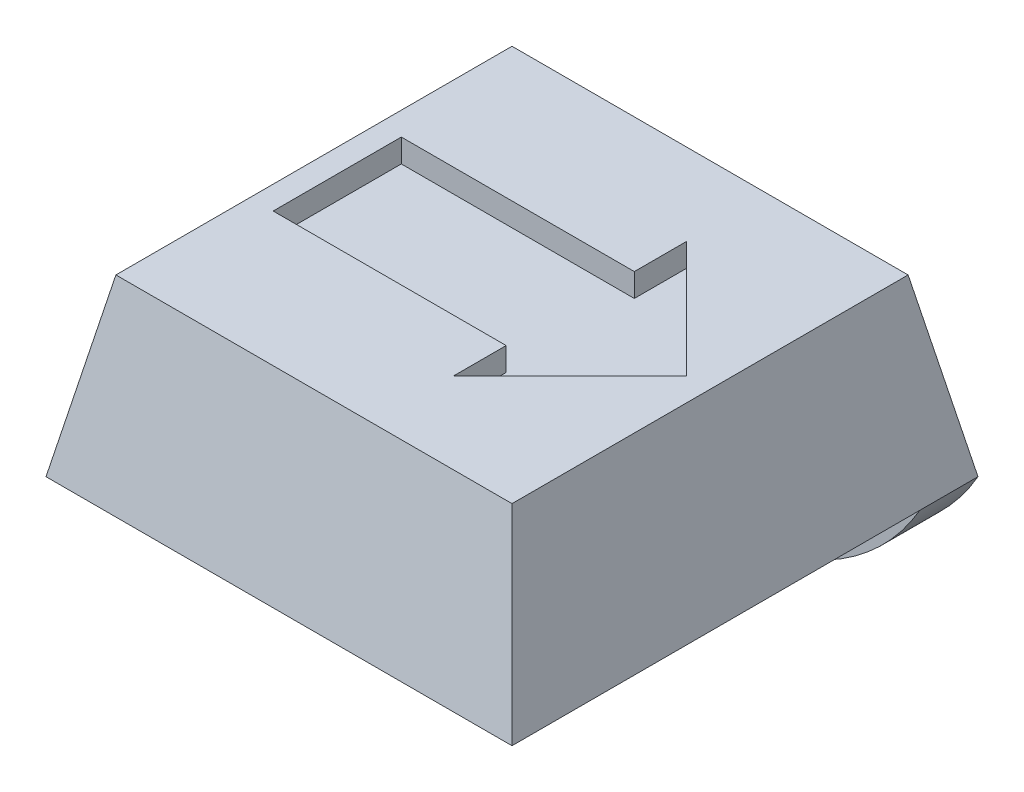
from build123d import *

# Parameters (mm, degrees)
SKETCH1_W               = 8
SKETCH1_H               = 8
BOSS_EXTRUDE1_DEPTH     = 3
CUT_EXTRUDE1_DEPTH      = 12.704699911
CUT_EXTRUDE1_DEPTH_BACK = 12.704699911
CUT_EXTRUDE2_DEPTH      = 11
SKETCH4_R               = 1.75
CUT_EXTRUDE3_DEPTH      = 0.4
SKETCH5_W               = 8
SKETCH5_H               = 1
BOSS_EXTRUDE2_DEPTH     = 2
FILLET1_R               = 4
SKETCH6_W               = 4
SKETCH6_H               = 2.2
CUT_EXTRUDE4_DEPTH      = 0.4


with BuildPart() as part:
    # Sketch1 → Boss-Extrude1 (new body)
    with BuildSketch(Plane(origin=(0, 0, 0), x_dir=(1, 0, 0), z_dir=(0, 1, 0))):
        with Locations((4, 4)):
            Rectangle(SKETCH1_W, SKETCH1_H)
    extrude(amount=BOSS_EXTRUDE1_DEPTH)

    # Sketch2 → Cut-Extrude1 (cut, two sides: drawn at the far end of the back side and taken through both)
    with BuildSketch(Plane.XY.offset(-CUT_EXTRUDE1_DEPTH_BACK)):
        Polygon((0, 0), (0.6, 3), (0, 3), align=None)
        Polygon((8, 0), (7.4, 3), (8, 3), align=None)
    extrude(amount=CUT_EXTRUDE1_DEPTH + CUT_EXTRUDE1_DEPTH_BACK, mode=Mode.SUBTRACT)

    # Sketch3 → Cut-Extrude2 (cut)
    with BuildSketch(Plane(origin=(0, 0, 0), x_dir=(0, 0, -1), z_dir=(1, 0, 0))):
        Polygon((0, 0), (0.6, 3), (0, 3), align=None)
        Polygon((8, 3), (7.4, 3), (8, 0), align=None)
    extrude(amount=CUT_EXTRUDE2_DEPTH, mode=Mode.SUBTRACT)

    # Sketch4 → Cut-Extrude3 (cut)
    with BuildSketch(Plane.XZ):
        with Locations(Location((4, -3.75, 0), (0, 0, 270))):
            Circle(SKETCH4_R)
    extrude(amount=-CUT_EXTRUDE3_DEPTH, mode=Mode.SUBTRACT)

    # Sketch5 → Boss-Extrude2 (add)
    with BuildSketch(Plane.XZ):
        with Locations((4, -7.5)):
            Rectangle(SKETCH5_W, SKETCH5_H)
    extrude(amount=BOSS_EXTRUDE2_DEPTH)

    # Fillet1
    # the kernel refuses this fillet: 4 mm, written as the material it takes off along each edge
    with BuildSketch(Plane(origin=(8, -2, -16.660254038), x_dir=(0, 1, 0), z_dir=(0, 0, 1)), Plane(origin=(0, -2, 1.660254038), x_dir=(0, 1, 0), z_dir=(0, 0, -1))) as fillet1_piece_1:
        with BuildLine():
            CenterArc((4, 3.464101615), FILLET1_R, 180, 60)
            Line((0, 3.464101615), (-0.08, 3.464101615))
            Line((-0.08, 3.464101615), (-0.08, 0))
            Line((-0.08, 0), (0, -0.08))
            ThreePointArc((0, -0.08), (1, -0.08), (1.96, -0.069282032))
            Line((1.96, -0.069282032), (2, 0))
        make_face()
    extrude(amount=18.320508076, mode=Mode.SUBTRACT)

    # Sketch6 → Cut-Extrude4 (cut)
    with BuildSketch(Plane(origin=(0, 3, 0), x_dir=(1, 0, 0), z_dir=(0, 1, 0))):
        with Locations((3, 4)):
            Rectangle(SKETCH6_W, SKETCH6_H)
        Polygon((5, 2), (5, 2.9), (5, 5.1), (5, 6), (7, 4), align=None)
    extrude(amount=-CUT_EXTRUDE4_DEPTH, mode=Mode.SUBTRACT)


solid = part.part
